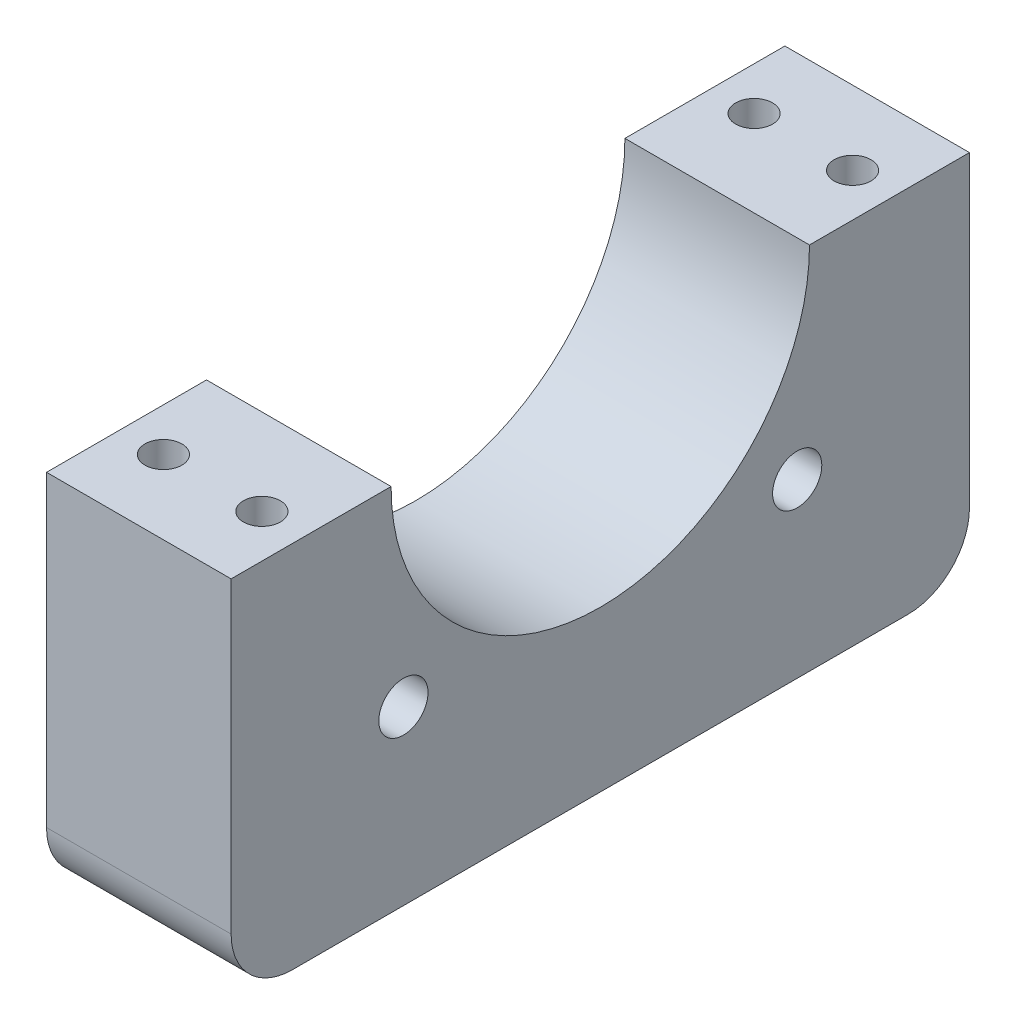
from build123d import *

# Parameters (mm, degrees)
SKETCH1_W           = 15
SKETCH1_H           = 60
BOSS_EXTRUDE1_DEPTH = 70
SKETCH2_R           = 17
CUT_EXTRUDE1_DEPTH  = 70
SKETCH3_W           = 60
SKETCH3_H           = 40
CUT_EXTRUDE2_DEPTH  = 29
SKETCH4_R           = 1.5
CUT_EXTRUDE3_DEPTH  = 43
SKETCH5_R           = 2
CUT_EXTRUDE4_DEPTH  = 10
SKETCH7_R           = 3
CUT_EXTRUDE5_DEPTH  = 10
FILLET1_R           = 5


with BuildPart() as part:
    # Sketch1 → Boss-Extrude1 (new body)
    with BuildSketch(Plane(origin=(0, 0, 0), x_dir=(1, 0, 0), z_dir=(0, 1, 0))):
        Rectangle(SKETCH1_W, SKETCH1_H)
    extrude(amount=BOSS_EXTRUDE1_DEPTH)

    # Sketch2 → Cut-Extrude1 (cut)
    with BuildSketch(Plane(origin=(7.5, 0, 0), x_dir=(0, 0, -1), z_dir=(1, 0, 0))):
        with Locations((0, 30)):
            Circle(SKETCH2_R)
    extrude(amount=-CUT_EXTRUDE1_DEPTH, mode=Mode.SUBTRACT)

    # Sketch3 → Cut-Extrude2 (cut)
    with BuildSketch(Plane(origin=(7.5, 0, 0), x_dir=(0, 0, -1), z_dir=(1, 0, 0))):
        with Locations((0, 50)):
            Rectangle(SKETCH3_W, SKETCH3_H)
    extrude(amount=-CUT_EXTRUDE2_DEPTH, mode=Mode.SUBTRACT)

    # Sketch4 → Cut-Extrude3 (cut)
    with BuildSketch(Plane(origin=(0, 30, 0), x_dir=(1, 0, 0), z_dir=(0, 1, 0))):
        with Locations(Location((-4, 24, 0), (0, 0, 270))):
            Circle(SKETCH4_R)
        with Locations(Location((4, 24, 0), (0, 0, 270))):
            Circle(SKETCH4_R)
        with Locations(Location((-4, -24, 0), (0, 0, 270))):
            Circle(SKETCH4_R)
        with Locations(Location((4, -24, 0), (0, 0, 270))):
            Circle(SKETCH4_R)
    extrude(amount=-CUT_EXTRUDE3_DEPTH, mode=Mode.SUBTRACT)

    # Sketch5 → Cut-Extrude4 (cut)
    with BuildSketch(Plane(origin=(7.5, 0, 0), x_dir=(0, 0, -1), z_dir=(1, 0, 0))):
        with Locations((-16, 14)):
            Circle(SKETCH5_R)
        with Locations((16, 14)):
            Circle(SKETCH5_R)
    extrude(amount=-CUT_EXTRUDE4_DEPTH, mode=Mode.SUBTRACT)

    # Sketch7 → Cut-Extrude5 (cut)
    with BuildSketch(Plane.XZ):
        with Locations(Location((-4, 24, 0), (0, 0, 270))):
            Circle(SKETCH7_R)
        with Locations(Location((4, 24, 0), (0, 0, 270))):
            Circle(SKETCH7_R)
        with Locations(Location((-4, -24, 0), (0, 0, 270))):
            Circle(SKETCH7_R)
        with Locations(Location((4, -24, 0), (0, 0, 270))):
            Circle(SKETCH7_R)
    extrude(amount=-CUT_EXTRUDE5_DEPTH, mode=Mode.SUBTRACT)

    # Fillet1
    # the kernel refuses this fillet: 5 mm, written as the material it takes off along each edge
    with BuildSketch(Plane(origin=(-20, 0, -30), x_dir=(0, 0, 1), z_dir=(1, 0, 0))) as fillet1_piece_1:
        with BuildLine():
            CenterArc((FILLET1_R, -FILLET1_R), FILLET1_R, 90, 90)
            Line((0, -FILLET1_R), (0, 0))
            Line((0, 0), (FILLET1_R, 0))
        make_face()
    extrude(amount=40, mode=Mode.SUBTRACT)
    with BuildSketch(Plane(origin=(20, 0, 30), x_dir=(0, 1, 0), z_dir=(-1, 0, 0))) as fillet1_piece_2:
        with BuildLine():
            CenterArc((FILLET1_R, FILLET1_R), FILLET1_R, 180, 90)
            Line((0, FILLET1_R), (0, 0))
            Line((0, 0), (FILLET1_R, 0))
        make_face()
    extrude(amount=40, mode=Mode.SUBTRACT)


solid = part.part
